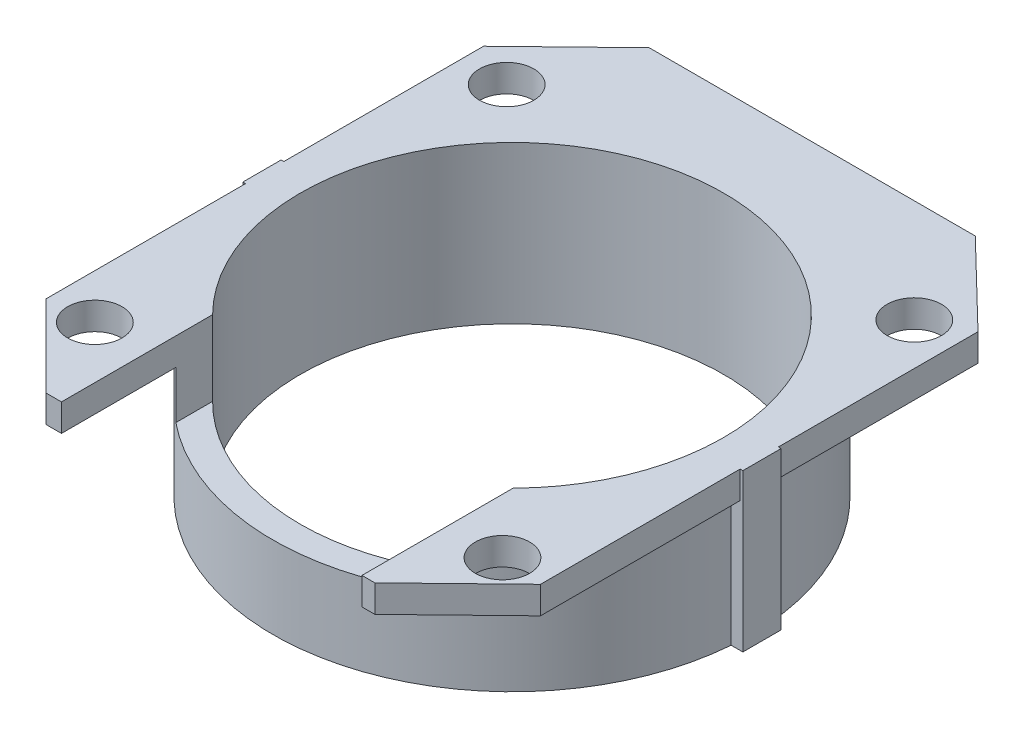
from build123d import *

# Parameters (mm, degrees)
SKETCH1_R              = 17.5
SKETCH1_R_2            = 1.989574321
BOSS_EXTRUDE1_DEPTH    = 2
EXTRUDE_THIN1_START    = -9.5
SKETCH1_3_R            = 17.5
SKETCH1_3_R_2          = 15.5
EXTRUDE_THIN1_DEPTH    = 11.5
BOSS_EXTRUDE2_START    = -9.5
SKETCH1_4_W            = 0.2
SKETCH1_4_H            = 2.8
BOSS_EXTRUDE2_DEPTH    = 9.5
CUT_EXTRUDE1_START     = -11.064631417
CUT_EXTRUDE1_OUTLINE_W = 22
CUT_EXTRUDE1_OUTLINE_H = 5.5
CUT_EXTRUDE1_DEPTH     = 11.064631417


# Read off the part's stored shape, not the designer's step: Cut-Extrude1
with BuildPart() as part:
    # Sketch1 → Boss-Extrude1 (new body)
    with BuildSketch(Plane(origin=(0, 0, 0), x_dir=(1, 0, 0), z_dir=(0, 1, 0))):
        Polygon((-18.1, -16.016775893), (-12.131979642, -21.984796251), (11.942572252, -21.984796251), (18.1, -16.016073287), (18.1, -1.4), (18.3, -1.4), (18.3, 1.4), (18.1, 1.4), (18.1, 16.016073287), (11.932319604, 21.984796251), (-11.943274858, 21.984796251), (-18.1, 16.01675436), (-18.1, 1.4), (-18.3, 1.4), (-18.3, -1.4), (-18.1, -1.4), align=None)
        with Locations(Location((0, 0, 0), (0, 0, 270))):
            Circle(SKETCH1_R, mode=Mode.SUBTRACT)
        with Locations(Location((-14.8230313, -15.717637138, 0), (0, 0, 270))):
            Circle(SKETCH1_R_2, mode=Mode.SUBTRACT)
        with Locations(Location((15.02058352, -15.717637138, 0), (0, 0, 270))):
            Circle(SKETCH1_R_2, mode=Mode.SUBTRACT)
        with Locations(Location((-14.8230313, 14.432362862, 0), (0, 0, 270))):
            Circle(SKETCH1_R_2, mode=Mode.SUBTRACT)
        with Locations(Location((15.02058352, 14.432362862, 0), (0, 0, 270))):
            Circle(SKETCH1_R_2, mode=Mode.SUBTRACT)
    extrude(amount=BOSS_EXTRUDE1_DEPTH)

    # Sketch1<3> → Extrude-Thin1 (add)
    with BuildSketch(Plane(origin=(0, 0, 0), x_dir=(1, 0, 0), z_dir=(0, 1, 0)).offset(EXTRUDE_THIN1_START)):
        Circle(SKETCH1_3_R)
        Circle(SKETCH1_3_R_2, mode=Mode.SUBTRACT)
    extrude(amount=EXTRUDE_THIN1_DEPTH)

    # Sketch1<4> → Boss-Extrude2 (add)
    with BuildSketch(Plane(origin=(0, 0, 0), x_dir=(1, 0, 0), z_dir=(0, 1, 0)).offset(BOSS_EXTRUDE2_START)):
        with Locations((-18.2, 0)):
            Rectangle(SKETCH1_4_W, SKETCH1_4_H)
        with Locations((18.2, 0)):
            Rectangle(SKETCH1_4_W, SKETCH1_4_H)
        with BuildLine():
            ThreePointArc((17.5, 0), (17.485971906, -0.700561574), (17.443910112, -1.4))
            Line((17.443910112, -1.4), (18.1, -1.4))
            Line((18.1, -1.4), (18.1, 1.4))
            Line((18.1, 1.4), (17.443910112, 1.4))
            ThreePointArc((17.443910112, 1.4), (17.485971906, 0.700561574), (17.5, 0))
        make_face()
        with BuildLine():
            Line((-18.1, 1.4), (-18.1, -1.4))
            Line((-18.1, -1.4), (-17.443910112, -1.4))
            ThreePointArc((-17.443910112, -1.4), (-17.5, 0), (-17.443910112, 1.4))
            Line((-17.443910112, 1.4), (-18.1, 1.4))
        make_face()
    extrude(amount=BOSS_EXTRUDE2_DEPTH)

    # Cut-Extrude1 outline → Cut-Extrude1 (cut)
    with BuildSketch(Plane.XY.offset(21.984796251).offset(CUT_EXTRUDE1_START)):
        with Locations((0, -0.75)):
            Rectangle(CUT_EXTRUDE1_OUTLINE_W, CUT_EXTRUDE1_OUTLINE_H)
    extrude(amount=CUT_EXTRUDE1_DEPTH, mode=Mode.SUBTRACT)


solid = part.part
